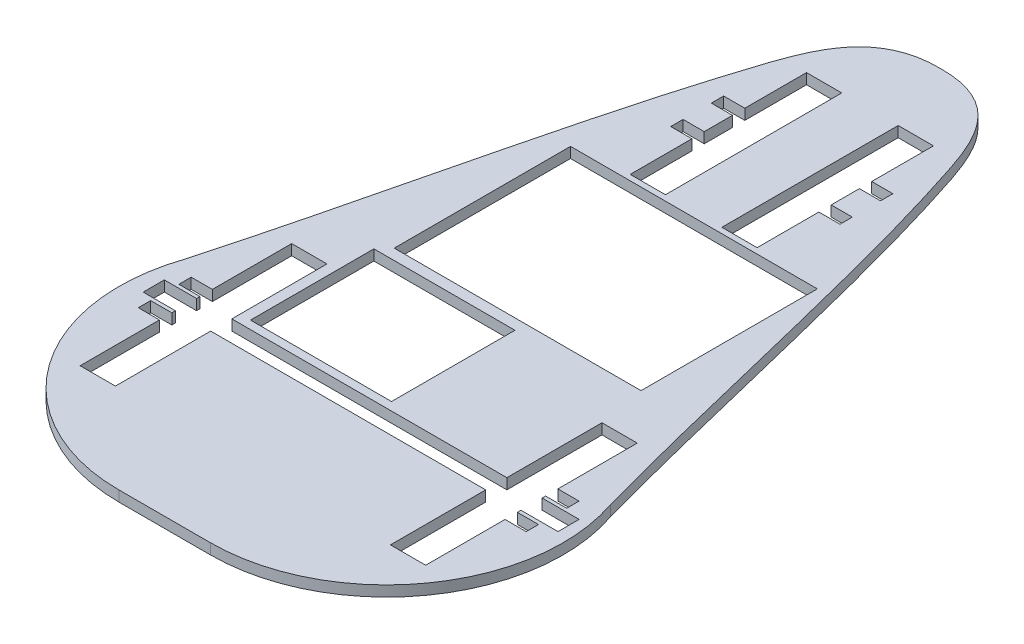
from build123d import *

# Parameters (mm, degrees)
SKETCH1_W           = 40
SKETCH1_H           = 35
SKETCH1_W_2         = 70
SKETCH1_H_2         = 50
BOSS_EXTRUDE1_DEPTH = 3


with BuildPart() as part:
    # Sketch1 → Boss-Extrude1 (new body)
    with BuildSketch(Plane(origin=(0, 0, 0), x_dir=(1, 0, 0), z_dir=(0, 1, 0))):
        with BuildLine():
            ThreePointArc((-5.402835029, 56.779327706), (1.307684551, 11.589070443), (41.947000955, -9.282833803))
            Line((41.947000955, -9.282833803), (44.921096163, -9.282833803))
            Line((44.921096163, -9.282833803), (54.921096163, -9.282833803))
            Line((54.921096163, -9.282833803), (64.921096163, -9.282833803))
            Line((64.921096163, -9.282833803), (67.895191372, -9.282833803))
            ThreePointArc((67.895191372, -9.282833803), (108.534507775, 11.589070443), (115.245027355, 56.779327706))
            add(Edge.make_bspline(
                [(54.921096163, 210.717166197), (55.81137082, 210.717166197), (73.117417783, 210.307734869), (83.16859041, 181.782071598), (97.327576281, 130.307148929), (107.260265849, 85.588568729), (115.245027355, 56.779327706)],
                knots=[0, 0, 0, 0, 0.011068306, 0.221366129, 0.459883163, 1, 1, 1, 1], degree=3))
            add(Edge.make_bspline(
                [(54.921096163, 210.717166197), (54.030821506, 210.717166197), (36.724774544, 210.307734869), (26.673601916, 181.782071598), (12.514616045, 130.307148929), (2.581926477, 85.588568729), (-5.402835029, 56.779327706)],
                knots=[0, 0, 0, 0, 0.011068306, 0.221366129, 0.459883163, 1, 1, 1, 1], degree=3))
        make_face()
        with Locations((38.870747079, 68.582402682)):
            Rectangle(SKETCH1_W, SKETCH1_H, mode=Mode.SUBTRACT)
        Polygon((-0.078903837, 49.717166197), (-0.078903837, 53.217166197), (5.921096163, 53.217166197), (5.921096163, 75.717166197), (15.921096163, 75.717166197), (15.921096163, 48.736405384), (93.921096163, 48.736405384), (93.921096163, 75.717166197), (103.921096163, 75.717166197), (103.921096163, 53.217166197), (109.921096163, 53.217166197), (109.921096163, 49.717166197), (103.921096163, 49.717166197), (103.921096163, 48.736405384), (114.420720505, 48.736405384), (114.420720505, 42.736405384), (103.921096163, 42.736405384), (103.921096163, 41.717166197), (109.921096163, 41.717166197), (109.921096163, 38.217166197), (103.921096163, 38.217166197), (103.921096163, 15.717166197), (93.921096163, 15.717166197), (93.921096163, 42.736405384), (15.921096163, 42.736405384), (15.921096163, 15.717166197), (5.921096163, 15.717166197), (5.921096163, 38.217166197), (-0.078903837, 38.217166197), (-0.078903837, 41.717166197), (5.921096163, 41.717166197), (5.921096163, 42.736405384), (-3.221531429, 42.736405384), (-3.221531429, 48.736405384), (5.921096163, 48.736405384), (5.921096163, 49.717166197), align=None, mode=Mode.SUBTRACT)
        Polygon((30.921096163, 169.717166197), (30.921096163, 173.217166197), (36.921096163, 173.217166197), (36.921096163, 190.717166197), (46.921096163, 190.717166197), (46.921096163, 140.717166197), (36.921096163, 140.717166197), (36.921096163, 158.217166197), (30.921096163, 158.217166197), (30.921096163, 161.717166197), (36.921096163, 161.717166197), (36.921096163, 169.717166197), align=None, mode=Mode.SUBTRACT)
        with Locations((56.576602309, 114.134229743)):
            Rectangle(SKETCH1_W_2, SKETCH1_H_2, mode=Mode.SUBTRACT)
        Polygon((72.921096163, 161.717166197), (78.921096163, 161.717166197), (78.921096163, 158.217166197), (72.921096163, 158.217166197), (72.921096163, 140.717166197), (62.921096163, 140.717166197), (62.921096163, 190.717166197), (72.921096163, 190.717166197), (72.921096163, 173.217166197), (78.921096163, 173.217166197), (78.921096163, 169.717166197), (72.921096163, 169.717166197), align=None, mode=Mode.SUBTRACT)
    extrude(amount=BOSS_EXTRUDE1_DEPTH)


solid = part.part
